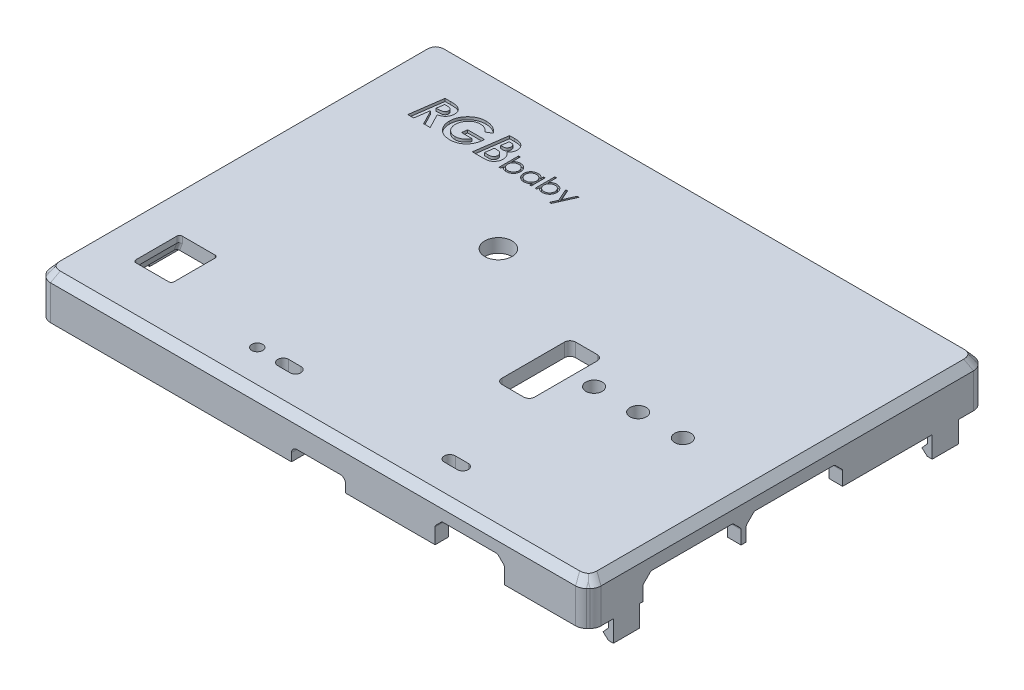
from build123d import *
from OCP.BRepFilletAPI import BRepFilletAPI_MakeChamfer

# Parameters (mm, degrees)
SKETCH1_W           = 101
SKETCH1_H           = 73
BOSS_EXTRUDE1_DEPTH = 7.85
SHELL3_T            = -2.5
SKETCH2_W           = 9.94
SKETCH2_H           = 2.46
CUT_EXTRUDE1_DEPTH  = 10
SKETCH3_W           = 12.7
SKETCH3_H           = 4.29
CUT_EXTRUDE2_DEPTH  = 10
SKETCH4_W           = 18.026547022
SKETCH4_H           = 4.15
SKETCH4_W_2         = 17.7
CUT_EXTRUDE3_DEPTH  = 10
SKETCH5_W           = 22.18
SKETCH5_H           = 1.5
CUT_EXTRUDE4_DEPTH  = 10
SKETCH6_W           = 18.18
SKETCH6_H           = 1.5
CUT_EXTRUDE5_DEPTH  = 10
SKETCH7_W           = 8
SKETCH7_H           = 5
CUT_EXTRUDE6_DEPTH  = 10
FILLET1_R           = 0.5
FILLET2_R           = 1
CHAMFER1_SIZE       = 1.25
CHAMFER2_SIZE       = 1.5
FILLET3_R           = 0.5
CHAMFER3_SIZE       = 1.5
CHAMFER4_SIZE       = 1.5
CHAMFER4_SIZE2      = 1.258649447
FILLET4_R           = 2
FILLET5_R           = 2.6
SKETCH8_W           = 7
SKETCH8_H           = 8.5
CUT_EXTRUDE7_DEPTH  = 5
CHAMFER5_SIZE       = 0.5
CHAMFER5_SIZE2      = 1.37373871
SKETCH9_R           = 1
SKETCH9_W           = 6
SKETCH9_H           = 13.5
SKETCH9_R_2         = 1.5
SKETCH9_R_3         = 2.5
CUT_EXTRUDE8_DEPTH  = 63.538968
FILLET6_R           = 1
CUT_EXTRUDE9_DEPTH  = 0.5
FILLET7_R           = 0.5
SKETCH11_W          = 0.9
SKETCH11_H          = 4.8
BOSS_EXTRUDE2_DEPTH = 3.9
SKETCH12_W          = 0.9
SKETCH12_H          = 4.8
BOSS_EXTRUDE3_DEPTH = 3.9
SKETCH13_W          = 0.9
SKETCH13_H          = 4.8
BOSS_EXTRUDE4_DEPTH = 3.9
SKETCH15_W          = 0.9
SKETCH15_H          = 4.8
BOSS_EXTRUDE6_DEPTH = 3.9
BOSS_EXTRUDE7_DEPTH = 4.8
BOSS_EXTRUDE8_DEPTH = 4.8


with BuildPart() as part:
    # Sketch1 → Boss-Extrude1 (new body)
    with BuildSketch(Plane(origin=(0, 0, 0), x_dir=(1, 0, 0), z_dir=(0, 1, 0))):
        Rectangle(SKETCH1_W, SKETCH1_H)
    extrude(amount=BOSS_EXTRUDE1_DEPTH)

    # Shell3
    shell3_openings = [part.faces().sort_by_distance(p)[0] for p in [
        (0, 0, 0),
    ]]
    offset(amount=SHELL3_T, openings=shell3_openings, kind=Kind.INTERSECTION)

    # Sketch2 → Cut-Extrude1 (cut)
    with BuildSketch(Plane.XY.offset(36.5)):
        with Locations((1.01, 1.23)):
            Rectangle(SKETCH2_W, SKETCH2_H)
    extrude(amount=-CUT_EXTRUDE1_DEPTH, mode=Mode.SUBTRACT)

    # Sketch3 → Cut-Extrude2 (cut)
    with BuildSketch(Plane.XY.offset(36.5)):
        with Locations((28.744046951, 2.145)):
            Rectangle(SKETCH3_W, SKETCH3_H)
    extrude(amount=-CUT_EXTRUDE2_DEPTH, mode=Mode.SUBTRACT)

    # Sketch4 → Cut-Extrude3 (cut)
    with BuildSketch(Plane(origin=(50.5, 0, 0), x_dir=(0, 0, -1), z_dir=(1, 0, 0))):
        with Locations((-17.486726489, 2.075)):
            Rectangle(SKETCH4_W, SKETCH4_H)
        with Locations((1.314047022, 2.075)):
            Rectangle(SKETCH4_W_2, SKETCH4_H)
    extrude(amount=-CUT_EXTRUDE3_DEPTH, mode=Mode.SUBTRACT)

    # Sketch5 → Cut-Extrude4 (cut)
    with BuildSketch(Plane(origin=(0, 0, -36.5), x_dir=(-1, 0, 0), z_dir=(0, 0, -1))):
        with Locations((-31.75, 0.75)):
            Rectangle(SKETCH5_W, SKETCH5_H)
        with Locations((0.25, 0.75)):
            Rectangle(SKETCH5_W, SKETCH5_H)
        with Locations((32.25, 0.75)):
            Rectangle(SKETCH5_W, SKETCH5_H)
    extrude(amount=-CUT_EXTRUDE4_DEPTH, mode=Mode.SUBTRACT)

    # Sketch6 → Cut-Extrude5 (cut)
    with BuildSketch(Plane.ZY.offset(50.5)):
        with Locations((3.45, 0.75)):
            Rectangle(SKETCH6_W, SKETCH6_H)
    extrude(amount=-CUT_EXTRUDE5_DEPTH, mode=Mode.SUBTRACT)

    # Sketch7 → Cut-Extrude6 (cut)
    with BuildSketch(Plane.ZY.offset(50.5)):
        with Locations((22.5, 2.5)):
            Rectangle(SKETCH7_W, SKETCH7_H)
    extrude(amount=-CUT_EXTRUDE6_DEPTH, mode=Mode.SUBTRACT)

    # Fillet1
    fillet1_edges = [part.edges().sort_by_distance(p)[0] for p in [
        (42.84, 1.5, -35.25),
        (20.66, 1.5, -35.25),
        (10.84, 1.5, -35.25),
        (-11.34, 1.5, -35.25),
        (-21.16, 1.5, -35.25),
        (-43.34, 1.5, -35.25),
        (-49.25, 1.5, -5.64),
        (-49.25, 1.5, 12.54),
    ]]
    fillet(fillet1_edges, radius=FILLET1_R)

    # Fillet2
    fillet2_edges = [part.edges().sort_by_distance(p)[0] for p in [
        (-3.96, 2.46, 35.25),
        (5.98, 2.46, 35.25),
    ]]
    fillet(fillet2_edges, radius=FILLET2_R)

    # Chamfer1
    chamfer1_edges = [part.edges().sort_by_distance(p)[0] for p in [
        (22.394046951, 4.29, 35.25),
        (35.094046951, 4.29, 35.25),
    ]]
    chamfer(chamfer1_edges, length=CHAMFER1_SIZE)

    # Chamfer2
    chamfer2_edges = [part.edges().sort_by_distance(p)[0] for p in [
        (49.25, 4.15, 26.5),
        (49.25, 4.15, 8.473452978),
        (49.25, 4.15, 7.535952978),
        (49.25, 4.15, -10.164047022),
    ]]
    chamfer(chamfer2_edges, length=CHAMFER2_SIZE)

    # Fillet3
    fillet3_edges = [part.edges().sort_by_distance(p)[0] for p in [
        (23.644046951, 4.29, 35.25),
        (33.844046951, 4.29, 35.25),
        (35.094046951, 3.04, 35.25),
        (22.394046951, 3.04, 35.25),
        (49.25, 4.15, 6.035952978),
        (49.25, 4.15, -8.664047022),
        (49.25, 2.65, -10.164047022),
        (49.25, 2.65, 7.535952978),
        (49.25, 4.15, 25),
        (49.25, 4.15, 9.973452978),
        (49.25, 2.65, 8.473452978),
        (49.25, 2.65, 26.5),
    ]]
    fillet(fillet3_edges, radius=FILLET3_R)

    # Chamfer3
    chamfer3_edges = [part.edges().sort_by_distance(p)[0] for p in [
        (50.5, 3.925, 36.5),
        (-50.5, 3.925, 36.5),
        (-50.5, 3.925, -36.5),
        (50.5, 3.925, -36.5),
    ]]
    chamfer(chamfer3_edges, length=CHAMFER3_SIZE)

    # Chamfer4: one chamfer whose edges measure the first distance from different faces: ONE call of the kernel's chamfer builder (chamfer() names one face for all edges)
    chamfer4_edges_1 = [part.edges().sort_by_distance(p)[0] for p in [
        (-50.5, 7.85, 0),
    ]]
    chamfer4_side_1 = [part.faces().sort_by_distance(p)[0] for p in [
        (-50.5, 4.222115859, -2.060200009),
    ]]
    chamfer4_edges_2 = [part.edges().sort_by_distance(p)[0] for p in [
        (0, 7.85, -36.5),
    ]]
    chamfer4_side_2 = [part.faces().sort_by_distance(p)[0] for p in [
        (0.037132849, 4.39689395, -36.5),
    ]]
    chamfer4_edges_3 = [part.edges().sort_by_distance(p)[0] for p in [
        (50.5, 7.85, 0),
    ]]
    chamfer4_side_3 = [part.faces().sort_by_distance(p)[0] for p in [
        (50.5, 4.597854749, -2.895488649),
    ]]
    chamfer4_edges_4 = [part.edges().sort_by_distance(p)[0] for p in [
        (0, 7.85, 36.5),
    ]]
    chamfer4_side_4 = [part.faces().sort_by_distance(p)[0] for p in [
        (-2.23114362, 4.159073824, 36.5),
    ]]
    chamfer4_edges_5 = [part.edges().sort_by_distance(p)[0] for p in [
        (-49.75, 7.85, 35.75),
    ]]
    chamfer4_side_5 = [part.faces().sort_by_distance(p)[0] for p in [
        (-49.75, 3.925, 35.75),
    ]]
    chamfer4_edges_6 = [part.edges().sort_by_distance(p)[0] for p in [
        (49.75, 7.85, 35.75),
    ]]
    chamfer4_side_6 = [part.faces().sort_by_distance(p)[0] for p in [
        (49.75, 3.925, 35.75),
    ]]
    chamfer4_edges_7 = [part.edges().sort_by_distance(p)[0] for p in [
        (49.75, 7.85, -35.75),
    ]]
    chamfer4_side_7 = [part.faces().sort_by_distance(p)[0] for p in [
        (49.75, 3.925, -35.75),
    ]]
    chamfer4_edges_8 = [part.edges().sort_by_distance(p)[0] for p in [
        (-49.75, 7.85, -35.75),
    ]]
    chamfer4_side_8 = [part.faces().sort_by_distance(p)[0] for p in [
        (-49.75, 3.925, -35.75),
    ]]
    chamfer4 = BRepFilletAPI_MakeChamfer(part.part.solid().wrapped)
    for e in chamfer4_edges_1:
        chamfer4.Add(CHAMFER4_SIZE, CHAMFER4_SIZE2, e.wrapped, chamfer4_side_1[0].wrapped)  # the first distance lies on this face
    for e in chamfer4_edges_2:
        chamfer4.Add(CHAMFER4_SIZE, CHAMFER4_SIZE2, e.wrapped, chamfer4_side_2[0].wrapped)  # the first distance lies on this face
    for e in chamfer4_edges_3:
        chamfer4.Add(CHAMFER4_SIZE, CHAMFER4_SIZE2, e.wrapped, chamfer4_side_3[0].wrapped)  # the first distance lies on this face
    for e in chamfer4_edges_4:
        chamfer4.Add(CHAMFER4_SIZE, CHAMFER4_SIZE2, e.wrapped, chamfer4_side_4[0].wrapped)  # the first distance lies on this face
    for e in chamfer4_edges_5:
        chamfer4.Add(CHAMFER4_SIZE, CHAMFER4_SIZE2, e.wrapped, chamfer4_side_5[0].wrapped)  # the first distance lies on this face
    for e in chamfer4_edges_6:
        chamfer4.Add(CHAMFER4_SIZE, CHAMFER4_SIZE2, e.wrapped, chamfer4_side_6[0].wrapped)  # the first distance lies on this face
    for e in chamfer4_edges_7:
        chamfer4.Add(CHAMFER4_SIZE, CHAMFER4_SIZE2, e.wrapped, chamfer4_side_7[0].wrapped)  # the first distance lies on this face
    for e in chamfer4_edges_8:
        chamfer4.Add(CHAMFER4_SIZE, CHAMFER4_SIZE2, e.wrapped, chamfer4_side_8[0].wrapped)  # the first distance lies on this face
    add(Compound.cast(chamfer4.Shape()), mode=Mode.REPLACE)

    # Fillet4
    fillet4_edges = [part.edges().sort_by_distance(p)[0] for p in [
        (-50.5, 3.175, 35),
        (-49, 3.175, -36.5),
        (50.5, 3.175, -35),
        (49, 3.175, 36.5),
        (49, 3.175, -36.5),
        (50.5, 3.175, 35),
        (-49, 3.175, 36.5),
        (-50.5, 3.175, -35),
    ]]
    fillet(fillet4_edges, radius=FILLET4_R)

    # Fillet5
    # the kernel refuses this fillet: 2.6 mm, written as the material it takes off along each edge
    with BuildSketch(Plane(origin=(-49.449728711, 5.05606408, -37.585741153), x_dir=(-0.80024425838159, -0.1970939943978457, 0.5663595009352286), z_dir=(0.2572879369705646, 0.7402553925543305, 0.6211480268693323)), Plane(origin=(-51.585741153, 5.05606408, -35.449728711), x_dir=(-0.16538149800648996, -0.19709399439784686, 0.966334785407951), z_dir=(0.6211480268693325, 0.7402553925543306, 0.25728793697056446)), Plane(origin=(51.585741153, 5.05606408, 35.449728711), x_dir=(0.1653814980064904, -0.19709399439784625, -0.966334785407951), z_dir=(-0.6211480268693326, 0.7402553925543306, -0.2572879369705643)), Plane(origin=(49.449728711, 5.05606408, 37.585741153), x_dir=(0.8002442583815859, -0.19709399439785075, -0.5663595009352324), z_dir=(-0.2572879369705643, 0.7402553925543306, -0.6211480268693326)), Plane(origin=(-49.449728711, 5.05606408, 37.585741153), x_dir=(0.9663347854079509, -0.1970939943978456, 0.16538149800649174), z_dir=(0.2572879369705646, 0.7402553925543305, -0.6211480268693323))) as fillet5_piece_1:
        with BuildLine():
            CenterArc((FILLET5_R * 0.306623823216, FILLET5_R), FILLET5_R, 235.906425585, 34.093574415)
            Line((-FILLET5_R * 0.253922302826, FILLET5_R * 0.171876796256), (0, 0))
            Line((0, 0), (FILLET5_R * 0.306623823216, 0))
        make_face()
    extrude(amount=5.767341331, mode=Mode.SUBTRACT)
    with BuildSketch(Plane(origin=(49.449728711, 5.05606408, -37.585741153), x_dir=(0.8002442583815883, -0.19709399439784797, 0.56635950093523), z_dir=(-0.2572879369705643, 0.7402553925543306, 0.6211480268693326)), Plane(origin=(51.585741153, 5.05606408, -35.449728711), x_dir=(0.1653814980064918, -0.19709399439784506, 0.966334785407951), z_dir=(-0.6211480268693326, 0.7402553925543306, 0.2572879369705643)), Plane(origin=(-51.585741153, 5.05606408, 35.449728711), x_dir=(-0.1653814980064911, -0.19709399439784595, -0.966334785407951), z_dir=(0.6211480268693325, 0.7402553925543306, -0.25728793697056446))) as fillet5_piece_2:
        with BuildLine():
            CenterArc((FILLET5_R * 0.306623823216, -FILLET5_R), FILLET5_R, 90, 34.093574415)
            Line((-FILLET5_R * 0.253922302826, -FILLET5_R * 0.171876796256), (0, 0))
            Line((0, 0), (FILLET5_R * 0.306623823216, 0))
        make_face()
    extrude(amount=5.767341331, mode=Mode.SUBTRACT)

    # Sketch8 → Cut-Extrude7 (cut)
    with BuildSketch(Plane(origin=(0, 7.85, 0), x_dir=(1, 0, 0), z_dir=(0, 1, 0))):
        with Locations((-39, -22.75)):
            Rectangle(SKETCH8_W, SKETCH8_H)
    extrude(amount=-CUT_EXTRUDE7_DEPTH, mode=Mode.SUBTRACT)

    # Chamfer5
    chamfer5_edges = [part.edges().sort_by_distance(p)[0] for p in [
        (-42.5, 5.35, 22.75),
    ]]
    chamfer5_side = [part.faces().sort_by_distance(p)[0] for p in [
        (0.358738502, 5.35, -0.209264126),
    ]]
    chamfer(chamfer5_edges, length=CHAMFER5_SIZE, length2=CHAMFER5_SIZE2, reference=chamfer5_side[0])

    # Sketch9 → Cut-Extrude8 (cut, through all)
    with BuildSketch(Plane.XZ.offset(-5.35)):
        with Locations((20.35, 29.37)):
            Circle(SKETCH9_R)
        with BuildLine():
            ThreePointArc((20.35, 28.37), (19.35, 29.37), (20.35, 30.37))
            Line((20.35, 30.37), (17.96125, 30.37))
            ThreePointArc((17.96125, 30.37), (18.668356781, 30.077106781), (18.96125, 29.37))
            ThreePointArc((18.96125, 29.37), (18.668356781, 28.662893219), (17.96125, 28.37))
            Line((17.96125, 28.37), (20.35, 28.37))
        make_face()
        with Locations((17.96125, 29.37)):
            Circle(SKETCH9_R)
        with Locations((-10.4, 29.32625)):
            Circle(SKETCH9_R)
        with BuildLine():
            Line((-12.65, 28.32625), (-10.4, 28.32625))
            ThreePointArc((-10.4, 28.32625), (-11.4, 29.32625), (-10.4, 30.32625))
            Line((-10.4, 30.32625), (-12.65, 30.32625))
            ThreePointArc((-12.65, 30.32625), (-11.942893219, 30.033356781), (-11.65, 29.32625))
            ThreePointArc((-11.65, 29.32625), (-11.942893219, 28.619143219), (-12.65, 28.32625))
        make_face()
        with Locations((-12.65, 29.32625)):
            Circle(SKETCH9_R)
        with Locations((12.9, 6)):
            Rectangle(SKETCH9_W, SKETCH9_H)
        with Locations(Location((36, 4.65, 0), (0, 0, 270))):
            Circle(SKETCH9_R_2)
        with Locations(Location((27.8, 4.65, 0), (0, 0, 270))):
            Circle(SKETCH9_R_2)
        with Locations(Location((19.7, 4.65, 0), (0, 0, 270))):
            Circle(SKETCH9_R_2)
        with Locations(Location((-11, -8.5, 0), (0, 0, 270))):
            Circle(SKETCH9_R_3)
        with Locations(Location((-17.43875, 29.30125, 0), (0, 0, 270))):
            Circle(SKETCH9_R)
    extrude(amount=-CUT_EXTRUDE8_DEPTH, mode=Mode.SUBTRACT)

    # Fillet6
    fillet6_edges = [part.edges().sort_by_distance(p)[0] for p in [
        (9.9, 6.6, -0.75),
        (9.9, 6.6, 12.75),
        (15.9, 6.6, 12.75),
        (15.9, 6.6, -0.75),
    ]]
    fillet(fillet6_edges, radius=FILLET6_R)

    # Sketch10 → Cut-Extrude9 (cut)
    # profile 1 of 7: a face of its own
    with BuildSketch(Plane(origin=(0, 7.85, 0), x_dir=(1, 0, 0), z_dir=(0, 1, 0))):
        with BuildLine():
            Line((-27.938465938, 27.5), (-27.039427476, 27.5))
            add(Edge.make_bspline(
                [(-27.039427476, 27.5), (-26.973306911, 27.499796766), (-26.845395145, 27.499403605), (-26.660222494, 27.489100944), (-26.487884601, 27.474724122), (-26.328360899, 27.456808782), (-26.182536115, 27.429710381), (-26.049507455, 27.398924327), (-25.929433848, 27.3624692), (-25.788389528, 27.304492776), (-25.629097559, 27.216104064), (-25.455127636, 27.086988544), (-25.304920913, 26.927752866), (-25.17331302, 26.748955846), (-25.066332591, 26.553117065), (-24.990513856, 26.345635951), (-24.942686866, 26.130772449), (-24.936681121, 25.984620467), (-24.933658246, 25.911057692)],
                knots=[0, 0, 0, 0, 1.060182399, 2.050947427, 2.972933909, 3.833603532, 4.623758792, 5.349968742, 6.022619805, 6.633490032, 7.792338899, 8.934684725, 10.0933911, 11.288487101, 12.487324871, 13.658169267, 14.821284765, 16, 16, 16, 16], degree=3))
            add(Edge.make_bspline(
                [(-24.933658246, 25.911057692), (-24.935904326, 25.849246744), (-24.940350186, 25.72689903), (-24.970895701, 25.545923474), (-25.023326617, 25.370716813), (-25.094804204, 25.201801173), (-25.18636653, 25.042720693), (-25.296633818, 24.895946559), (-25.425690991, 24.762795521), (-25.523647396, 24.686393165), (-25.573081322, 24.647836538)],
                knots=[0, 0, 0, 0, 1.008802286, 1.996808917, 2.985853824, 3.987935791, 4.984003692, 5.974085787, 6.977617699, 8, 8, 8, 8], degree=3))
            add(Edge.make_bspline(
                [(-25.573081322, 24.647836538), (-25.509796832, 24.600790122), (-25.386202057, 24.50890835), (-25.224619016, 24.349933059), (-25.087509165, 24.180565271), (-24.97370108, 24.000049287), (-24.887403901, 23.806230756), (-24.824457751, 23.601758575), (-24.786066713, 23.385655501), (-24.781925351, 23.237738765), (-24.779812092, 23.162259615)],
                knots=[0, 0, 0, 0, 1.076867414, 2.103124847, 3.088410714, 4.050300241, 5.011160291, 5.979497965, 6.968975523, 8, 8, 8, 8], degree=3))
            add(Edge.make_bspline(
                [(-24.779812092, 23.162259615), (-24.782758992, 23.08350271), (-24.788586361, 22.927764278), (-24.836834505, 22.699579974), (-24.917099914, 22.4820053), (-25.027844555, 22.278598159), (-25.159212366, 22.092327808), (-25.309857214, 21.93087079), (-25.474252088, 21.794811741), (-25.624852739, 21.70218801), (-25.756058904, 21.643141776), (-25.864680812, 21.604930544), (-25.983514047, 21.572158262), (-26.113035764, 21.546827689), (-26.252406745, 21.524336437), (-26.402225844, 21.511223627), (-26.562110246, 21.500524167), (-26.672418939, 21.500178396), (-26.729331322, 21.5)],
                knots=[0, 0, 0, 0, 1.303747164, 2.57810456, 3.844347155, 5.133141427, 6.403898642, 7.610790585, 8.780141826, 9.92981316, 10.526901919, 11.160883678, 11.835562906, 12.567100275, 13.346228134, 14.173084326, 15.057425816, 16, 16, 16, 16], degree=3))
            Line((-26.729331322, 21.5), (-28.779812092, 21.5))
            Line((-28.779812092, 21.5), (-27.938465938, 27.5))
        make_face()
        with BuildLine():
            Line((-27.188465938, 25.115384615), (-26.991350553, 25.115384615))
            add(Edge.make_bspline(
                [(-26.991350553, 25.115384615), (-26.955686885, 25.115543058), (-26.887545067, 25.115845791), (-26.790212621, 25.120071591), (-26.701498173, 25.123831029), (-26.62224478, 25.132813021), (-26.551117652, 25.141890782), (-26.489511522, 25.154208823), (-26.435805768, 25.16612664), (-26.377405446, 25.189760122), (-26.310824717, 25.224951473), (-26.240770609, 25.284991027), (-26.175375062, 25.357206629), (-26.118540444, 25.443788017), (-26.070732971, 25.540067667), (-26.035904248, 25.643533506), (-26.014781688, 25.752353204), (-26.011999422, 25.826427567), (-26.010581322, 25.864182692)],
                knots=[0, 0, 0, 0, 1.199333927, 2.291542006, 3.276678834, 4.184405191, 4.973343612, 5.686872737, 6.298011521, 6.818495195, 7.801417815, 8.815884106, 9.903594398, 11.069613373, 12.286904311, 13.509850177, 14.730790054, 16, 16, 16, 16], degree=3))
            add(Edge.make_bspline(
                [(-26.010581322, 25.864182692), (-26.011706555, 25.898712141), (-26.013907801, 25.9662607), (-26.031812141, 26.06349409), (-26.062482293, 26.153271997), (-26.104347003, 26.234583369), (-26.15547557, 26.306538758), (-26.21501617, 26.367140492), (-26.283670172, 26.413086048), (-26.347560463, 26.442085587), (-26.406247712, 26.45948311), (-26.46069664, 26.469606119), (-26.52483125, 26.479247929), (-26.598972172, 26.487639296), (-26.683181009, 26.493477903), (-26.777389272, 26.496663876), (-26.881562731, 26.499141521), (-26.954489897, 26.499705595), (-26.992552476, 26.5)],
                knots=[0, 0, 0, 0, 1.217888189, 2.382505203, 3.473394342, 4.554621668, 5.598222957, 6.577909812, 7.534682879, 8.496456537, 9.042175867, 9.690967717, 10.448749248, 11.330850431, 12.323004962, 13.426554395, 14.656852007, 16, 16, 16, 16], degree=3))
            Line((-26.992552476, 26.5), (-27.188465938, 25.115384615))
        make_face(mode=Mode.SUBTRACT)
        with BuildLine():
            Line((-27.55264863, 22.5), (-26.857937092, 22.475961538))
            add(Edge.make_bspline(
                [(-26.857937092, 22.475961538), (-26.815849239, 22.476688308), (-26.734364798, 22.478095375), (-26.616384382, 22.487896615), (-26.507004555, 22.502855583), (-26.40666669, 22.525269525), (-26.316244309, 22.556041714), (-26.233482433, 22.590296615), (-26.159580837, 22.632180679), (-26.095303876, 22.682464857), (-26.039104624, 22.737499566), (-25.98982001, 22.797263395), (-25.949511634, 22.862298951), (-25.914936449, 22.931684803), (-25.889151882, 23.006129065), (-25.869207183, 23.085237323), (-25.858852299, 23.169192803), (-25.857448973, 23.226738765), (-25.856735169, 23.256009615)],
                knots=[0, 0, 0, 0, 1.396545255, 2.703789819, 3.925918336, 5.057947269, 6.109009747, 7.09185152, 8.026860065, 8.917724649, 9.79206713, 10.633022212, 11.481406092, 12.325717456, 13.200363125, 14.090334412, 15.028645384, 16, 16, 16, 16], degree=3))
            add(Edge.make_bspline(
                [(-25.856735169, 23.256009615), (-25.858720841, 23.299398319), (-25.862601836, 23.384201479), (-25.889199465, 23.508480284), (-25.937279283, 23.624184642), (-26.00077132, 23.732542817), (-26.079281494, 23.82964293), (-26.172617726, 23.911662592), (-26.277802208, 23.977893481), (-26.375940572, 24.020673282), (-26.465196392, 24.048147706), (-26.547592875, 24.063547955), (-26.643180618, 24.079934742), (-26.753291846, 24.090652494), (-26.876582767, 24.102308798), (-27.014140374, 24.108684429), (-27.165594252, 24.113677441), (-27.271393475, 24.114798644), (-27.326687092, 24.115384615)],
                knots=[0, 0, 0, 0, 1.072622611, 2.096439365, 3.122744367, 4.15723709, 5.19210906, 6.195602288, 7.215049995, 8.252903698, 8.832552919, 9.520188734, 10.322946655, 11.229686895, 12.253743166, 13.384425235, 14.63302787, 16, 16, 16, 16], degree=3))
            Line((-27.326687092, 24.115384615), (-27.55264863, 22.5))
        make_face(mode=Mode.SUBTRACT)
    # profile 2 of 7: a face of its own
    with BuildSketch(Plane(origin=(0, 7.85, 0), x_dir=(1, 0, 0), z_dir=(0, 1, 0))):
        with BuildLine():
            Line((-29.803850553, 26.40625), (-30.759379399, 25.807692308))
            add(Edge.make_bspline(
                [(-30.759379399, 25.807692308), (-30.827150089, 25.881720893), (-30.956616747, 26.023142408), (-31.159685734, 26.208048813), (-31.359725046, 26.356960563), (-31.559833042, 26.470325096), (-31.764563752, 26.554511995), (-31.979636577, 26.611152641), (-32.207290275, 26.647172135), (-32.363406319, 26.651587368), (-32.44327363, 26.653846154)],
                knots=[0, 0, 0, 0, 1.232977487, 2.355435308, 3.369770187, 4.291348691, 5.174604885, 6.082334442, 7.018942652, 8, 8, 8, 8], degree=3))
            add(Edge.make_bspline(
                [(-32.44327363, 26.653846154), (-32.52999285, 26.65154757), (-32.700426933, 26.647030035), (-32.949005381, 26.60428078), (-33.185853633, 26.538899144), (-33.409958265, 26.444197902), (-33.621454694, 26.321658594), (-33.820596682, 26.172802989), (-34.007523472, 25.997486703), (-34.117771684, 25.863871082), (-34.174042861, 25.795673077)],
                knots=[0, 0, 0, 0, 1.037106879, 2.038283569, 3.009830787, 3.972569298, 4.94146214, 5.928319872, 6.942605276, 8, 8, 8, 8], degree=3))
            add(Edge.make_bspline(
                [(-34.174042861, 25.795673077), (-34.216314266, 25.738664053), (-34.299819415, 25.626045438), (-34.406410435, 25.446819054), (-34.498260097, 25.264308083), (-34.57355574, 25.07668609), (-34.631168643, 24.884320563), (-34.671858807, 24.686832412), (-34.698161025, 24.485083754), (-34.701307363, 24.348638552), (-34.702889015, 24.280048077)],
                knots=[0, 0, 0, 0, 1.040960542, 2.056368018, 3.055559505, 4.03710588, 5.019268411, 5.998275661, 6.99374091, 8, 8, 8, 8], degree=3))
            add(Edge.make_bspline(
                [(-34.702889015, 24.280048077), (-34.701270541, 24.213071765), (-34.698079907, 24.081035648), (-34.672943543, 23.887210308), (-34.628648734, 23.702107602), (-34.570567364, 23.52432124), (-34.492788772, 23.355462533), (-34.398644999, 23.194771624), (-34.287364808, 23.042683806), (-34.160334453, 22.900466694), (-34.021341109, 22.770621789), (-33.872946948, 22.656814227), (-33.716599511, 22.561021227), (-33.552236107, 22.482580174), (-33.379959036, 22.420839809), (-33.19934589, 22.378022983), (-33.011432331, 22.350472579), (-32.883275539, 22.347607189), (-32.81827363, 22.346153846)],
                knots=[0, 0, 0, 0, 1.066897471, 2.103265977, 3.106535126, 4.095591644, 5.078159493, 6.062322472, 7.058152725, 8.075375883, 9.096057735, 10.084186963, 11.049730852, 12.011871914, 12.980953841, 13.959387168, 14.96498868, 16, 16, 16, 16], degree=3))
            add(Edge.make_bspline(
                [(-32.81827363, 22.346153846), (-32.769360001, 22.34706009), (-32.672519325, 22.3488543), (-32.5291292, 22.363698843), (-32.388993194, 22.387810082), (-32.252297668, 22.421129865), (-32.119057085, 22.464941071), (-31.988990514, 22.518046446), (-31.861739284, 22.580097746), (-31.738721089, 22.652922581), (-31.619738854, 22.734178996), (-31.506474627, 22.825900641), (-31.399182289, 22.927519024), (-31.297001754, 23.038498963), (-31.199265627, 23.158248714), (-31.10945936, 23.289270146), (-31.023572557, 23.428672009), (-30.971949417, 23.526921932), (-30.945677476, 23.576923077)],
                knots=[0, 0, 0, 0, 0.990751711, 1.961520103, 2.916931976, 3.869720035, 4.809138875, 5.755683625, 6.713987145, 7.674487982, 8.649319602, 9.630449541, 10.623757948, 11.640402946, 12.684918653, 13.752145235, 14.856026455, 16, 16, 16, 16], degree=3))
            Line((-30.945677476, 23.576923077), (-32.839908246, 23.576923077))
            Line((-32.839908246, 23.576923077), (-32.702889015, 24.576923077))
            Line((-32.702889015, 24.576923077), (-29.625965938, 24.576923077))
            add(Edge.make_bspline(
                [(-29.625965938, 24.576923077), (-29.633662367, 24.456143012), (-29.648713052, 24.219952603), (-29.703180253, 23.876031243), (-29.783848353, 23.551688932), (-29.888412933, 23.245675998), (-30.017929687, 22.958563204), (-30.174411493, 22.691128756), (-30.354792286, 22.442367157), (-30.560710697, 22.215539485), (-30.786192182, 22.012010124), (-31.027021293, 21.832197513), (-31.285026585, 21.683045856), (-31.556768725, 21.559837618), (-31.843317222, 21.462932821), (-32.145400619, 21.394996192), (-32.462524833, 21.353120404), (-32.679119752, 21.348504592), (-32.789427476, 21.346153846)],
                knots=[0, 0, 0, 0, 1.148955532, 2.246830018, 3.301660101, 4.319666133, 5.314146826, 6.287838685, 7.257462643, 8.227280698, 9.191724348, 10.138440807, 11.076252923, 12.016254752, 12.968042649, 13.943717582, 14.952773983, 16, 16, 16, 16], degree=3))
            add(Edge.make_bspline(
                [(-32.789427476, 21.346153846), (-32.849942994, 21.346753916), (-32.969495478, 21.347939396), (-33.146027354, 21.360117635), (-33.317598889, 21.380909245), (-33.484102264, 21.408219315), (-33.646271573, 21.443125548), (-33.803273041, 21.486110817), (-33.955470983, 21.537781195), (-34.101913158, 21.599000995), (-34.245717837, 21.663594336), (-34.382421637, 21.740543093), (-34.515385439, 21.823137616), (-34.642518621, 21.914947444), (-34.765737577, 22.013532471), (-34.883175728, 22.120469956), (-34.995860675, 22.235336267), (-35.066302493, 22.316915499), (-35.101927476, 22.358173077)],
                knots=[0, 0, 0, 0, 1.111499042, 2.195841241, 3.24834816, 4.285223882, 5.294222847, 6.294054786, 7.273859608, 8.244193736, 9.208986092, 10.167555097, 11.123181443, 12.083077344, 13.046240314, 14.020501641, 14.998895854, 16, 16, 16, 16], degree=3))
            add(Edge.make_bspline(
                [(-35.101927476, 22.358173077), (-35.156079559, 22.426563494), (-35.263596361, 22.562349943), (-35.401619432, 22.781140437), (-35.519405221, 23.009316328), (-35.613729692, 23.248043422), (-35.68913792, 23.495479252), (-35.74177777, 23.752983597), (-35.773447065, 24.020037297), (-35.777672807, 24.201435988), (-35.779812092, 24.293269231)],
                knots=[0, 0, 0, 0, 0.999328569, 1.984127054, 2.959716786, 3.938705326, 4.922250225, 5.921072174, 6.947541011, 8, 8, 8, 8], degree=3))
            add(Edge.make_bspline(
                [(-35.779812092, 24.293269231), (-35.776938549, 24.405626125), (-35.771268347, 24.627333795), (-35.722377282, 24.953296043), (-35.646329478, 25.268276063), (-35.53567681, 25.570696501), (-35.395994332, 25.862273597), (-35.223435364, 26.140770128), (-35.022179487, 26.40928444), (-34.790469272, 26.660506601), (-34.539189861, 26.892684636), (-34.272370503, 27.096629674), (-33.992584466, 27.268295903), (-33.70211446, 27.410455856), (-33.398187825, 27.518545433), (-33.083475878, 27.59677379), (-32.756475376, 27.645249992), (-32.534386548, 27.650951617), (-32.421639015, 27.653846154)],
                knots=[0, 0, 0, 0, 1.022519879, 2.01768214, 2.99445506, 3.968403767, 4.944092992, 5.933246428, 6.946641619, 7.994936793, 9.040543676, 10.058341478, 11.047494914, 12.024771785, 12.997483176, 13.978673844, 14.973836105, 16, 16, 16, 16], degree=3))
            add(Edge.make_bspline(
                [(-32.421639015, 27.653846154), (-32.337017832, 27.652474785), (-32.168516319, 27.649744055), (-31.918046072, 27.620165604), (-31.670298838, 27.576696975), (-31.427674271, 27.51232779), (-31.191766158, 27.433822868), (-30.965778536, 27.339842904), (-30.751891594, 27.230686256), (-30.548520589, 27.10526268), (-30.353646155, 26.962132578), (-30.16358463, 26.798637244), (-29.978930982, 26.612415007), (-29.86305134, 26.475961565), (-29.803850553, 26.40625)],
                knots=[0, 0, 0, 0, 1.014010841, 2.019144067, 3.019687909, 4.027399918, 5.025300219, 5.998481464, 6.958680332, 7.901091373, 8.859847597, 9.854378501, 10.903841272, 12, 12, 12, 12], degree=3))
        make_face()
    # profile 3 of 7: a face of its own
    with BuildSketch(Plane(origin=(0, 7.85, 0), x_dir=(1, 0, 0), z_dir=(0, 1, 0))):
        with BuildLine():
            Line((-39.784619784, 27.5), (-38.742552476, 27.5))
            add(Edge.make_bspline(
                [(-38.742552476, 27.5), (-38.665219817, 27.499683975), (-38.516113152, 27.49907464), (-38.301692918, 27.490409909), (-38.104891621, 27.477337499), (-37.925943266, 27.460085865), (-37.764698451, 27.436150188), (-37.621492493, 27.407410613), (-37.495410704, 27.375405092), (-37.4197999, 27.345663474), (-37.384379399, 27.331730769)],
                knots=[0, 0, 0, 0, 1.348808202, 2.600664361, 3.742342956, 4.788858012, 5.735658768, 6.584006912, 7.336666444, 8, 8, 8, 8], degree=3))
            add(Edge.make_bspline(
                [(-37.384379399, 27.331730769), (-37.344500471, 27.313747278), (-37.266543477, 27.278592397), (-37.154835649, 27.219002718), (-37.050229962, 27.154808461), (-36.954460069, 27.083589292), (-36.865504928, 27.008344021), (-36.783916142, 26.928356967), (-36.71035067, 26.842400575), (-36.644036459, 26.752016587), (-36.58507015, 26.657321902), (-36.534453649, 26.557849554), (-36.490686436, 26.454441702), (-36.456507872, 26.345973087), (-36.428101375, 26.233745754), (-36.409729084, 26.117051625), (-36.396799532, 25.996284328), (-36.395737119, 25.914299118), (-36.395196707, 25.872596154)],
                knots=[0, 0, 0, 0, 1.116361014, 2.182309107, 3.229450697, 4.24598407, 5.225421932, 6.201651319, 7.158895679, 8.110002388, 9.060669178, 10.002827475, 10.956240434, 11.923213192, 12.902917952, 13.908279153, 14.936015885, 16, 16, 16, 16], degree=3))
            add(Edge.make_bspline(
                [(-36.395196707, 25.872596154), (-36.39646762, 25.821277786), (-36.398976608, 25.719967019), (-36.415370863, 25.570570664), (-36.445948185, 25.427209351), (-36.487126617, 25.28943148), (-36.538143386, 25.156344954), (-36.603936186, 25.030265577), (-36.679984481, 24.908996572), (-36.767812501, 24.794127853), (-36.865981459, 24.684605685), (-36.97933221, 24.586875572), (-37.101594033, 24.494364886), (-37.237789613, 24.41327606), (-37.384173236, 24.337951763), (-37.544083706, 24.27413244), (-37.714519754, 24.215237055), (-37.834026403, 24.185760735), (-37.895196707, 24.170673077)],
                knots=[0, 0, 0, 0, 0.995453645, 1.965186658, 2.910129054, 3.83459069, 4.752398018, 5.669942118, 6.588407184, 7.525617038, 8.471772905, 9.435289717, 10.423772802, 11.441988612, 12.505459691, 13.613754905, 14.778583949, 16, 16, 16, 16], degree=3))
            Line((-37.895196707, 24.170673077), (-36.510581322, 21.5))
            Line((-36.510581322, 21.5), (-37.713706322, 21.5))
            Line((-37.713706322, 21.5), (-39.069475553, 24.115384615))
            Line((-39.069475553, 24.115384615), (-39.171639015, 24.115384615))
            Line((-39.171639015, 24.115384615), (-39.539427476, 21.5))
            Line((-39.539427476, 21.5), (-40.625965938, 21.5))
            Line((-40.625965938, 21.5), (-39.784619784, 27.5))
        make_face()
        with BuildLine():
            add(Edge.make_bspline(
                [(-39.031014015, 25.115384615), (-38.95367903, 25.116102712), (-38.805756662, 25.117476251), (-38.594494279, 25.127030209), (-38.403984347, 25.142121992), (-38.234776299, 25.163689135), (-38.086425025, 25.189195262), (-37.95956073, 25.221037838), (-37.853601925, 25.258898083), (-37.766877371, 25.303796552), (-37.696624509, 25.356511734), (-37.635817638, 25.412767096), (-37.585184978, 25.475738747), (-37.543408496, 25.544369523), (-37.511187672, 25.618801675), (-37.487951477, 25.699539472), (-37.475104, 25.786044585), (-37.473128976, 25.845712836), (-37.472119784, 25.876201923)],
                knots=[0, 0, 0, 0, 1.892208387, 3.619318591, 5.173427176, 6.566868293, 7.791773198, 8.8545744, 9.763297566, 10.539470204, 11.233547833, 11.906251103, 12.5615143, 13.203742025, 13.866659999, 14.539934446, 15.25394049, 16, 16, 16, 16], degree=3))
            add(Edge.make_bspline(
                [(-37.472119784, 25.876201923), (-37.473426143, 25.910772145), (-37.475960301, 25.977833638), (-37.49787973, 26.074421526), (-37.535361199, 26.162039859), (-37.588036296, 26.239850967), (-37.653771986, 26.308460949), (-37.733965924, 26.364969184), (-37.82770176, 26.409452037), (-37.91550988, 26.438840511), (-37.998624867, 26.455863067), (-38.07610405, 26.467299944), (-38.167837239, 26.478336123), (-38.274100362, 26.48649703), (-38.394765677, 26.491895317), (-38.52977175, 26.497140915), (-38.67884622, 26.499006279), (-38.78301749, 26.499658733), (-38.837504399, 26.5)],
                knots=[0, 0, 0, 0, 0.974340854, 1.890087692, 2.776057671, 3.647490651, 4.526730822, 5.442477659, 6.397820337, 7.445016909, 8.045730266, 8.789007992, 9.653967296, 10.651691253, 11.794598421, 13.061237498, 14.462876682, 16, 16, 16, 16], degree=3))
            Line((-38.837504399, 26.5), (-39.031014015, 25.115384615))
        make_face(mode=Mode.SUBTRACT)
    # profile 4 of 7: a face of its own
    with BuildSketch(Plane(origin=(0, 7.85, 0), x_dir=(1, 0, 0), z_dir=(0, 1, 0))):
        with BuildLine():
            Line((-23.882376194, 21.5), (-23.882376194, 25.08974359))
            Line((-23.882376194, 25.08974359), (-23.56827363, 25.08974359))
            Line((-23.56827363, 25.08974359), (-23.56827363, 23.593549679))
            add(Edge.make_bspline(
                [(-23.56827363, 23.593549679), (-23.532880211, 23.634307611), (-23.463826192, 23.713828017), (-23.34804974, 23.817675666), (-23.226644171, 23.905728144), (-23.098685915, 23.978314262), (-22.963992982, 24.033587869), (-22.823260873, 24.074010259), (-22.676129833, 24.098397162), (-22.575810659, 24.101163235), (-22.525004399, 24.102564103)],
                knots=[0, 0, 0, 0, 1.077089805, 2.101446609, 3.097517232, 4.067117542, 5.031729543, 5.997785507, 6.985986182, 8, 8, 8, 8], degree=3))
            add(Edge.make_bspline(
                [(-22.525004399, 24.102564103), (-22.479838262, 24.101323874), (-22.39053711, 24.098871732), (-22.259254963, 24.080237237), (-22.132941687, 24.050019435), (-22.01166604, 24.008127255), (-21.895993907, 23.952544278), (-21.78493485, 23.88600297), (-21.679057865, 23.806764641), (-21.58000298, 23.71616633), (-21.488709094, 23.617809708), (-21.408796584, 23.512629392), (-21.341296887, 23.402154302), (-21.285465595, 23.286754239), (-21.242294542, 23.165957888), (-21.212552275, 23.03988369), (-21.19365881, 22.908655671), (-21.191278564, 22.819342868), (-21.190068502, 22.773938301)],
                knots=[0, 0, 0, 0, 1.034377878, 2.045141349, 3.03070803, 4.00595497, 4.978199603, 5.965204761, 6.967410914, 8.002051993, 9.036360596, 10.037508045, 11.022711142, 11.997267194, 12.969246472, 13.954813154, 14.960274251, 16, 16, 16, 16], degree=3))
            add(Edge.make_bspline(
                [(-21.190068502, 22.773938301), (-21.191304942, 22.729238284), (-21.193743008, 22.641096888), (-21.212364317, 22.511390332), (-21.243110581, 22.386551633), (-21.287071765, 22.266903376), (-21.342336703, 22.151883462), (-21.411447979, 22.042803058), (-21.491258978, 21.937764082), (-21.583590127, 21.840140451), (-21.68350368, 21.749907051), (-21.790417923, 21.671501186), (-21.901639844, 21.603784066), (-22.018902957, 21.550128618), (-22.140470998, 21.506727697), (-22.267646385, 21.476610006), (-22.399709613, 21.459036951), (-22.489428501, 21.456441384), (-22.534820105, 21.455128205)],
                knots=[0, 0, 0, 0, 1.024244038, 2.01964794, 2.996620209, 3.965911562, 4.936179293, 5.91563013, 6.920572822, 7.955171681, 8.990768464, 10.002129126, 10.989675881, 11.969873457, 12.952483066, 13.943799762, 14.959703725, 16, 16, 16, 16], degree=3))
            add(Edge.make_bspline(
                [(-22.534820105, 21.455128205), (-22.586785217, 21.456568813), (-22.688679741, 21.459393595), (-22.837732406, 21.482812574), (-22.978813956, 21.522674184), (-23.113531504, 21.57623594), (-23.239959227, 21.648764594), (-23.35889981, 21.738721344), (-23.469603182, 21.847588481), (-23.534819998, 21.930649971), (-23.56827363, 21.973257212)],
                knots=[0, 0, 0, 0, 1.035807596, 2.031038093, 2.998900396, 3.954262848, 4.914341711, 5.895762244, 6.92060972, 8, 8, 8, 8], degree=3))
            Line((-23.56827363, 21.973257212), (-23.56827363, 21.5))
            Line((-23.56827363, 21.5), (-23.882376194, 21.5))
        make_face()
        with BuildLine():
            add(Edge.make_bspline(
                [(-22.537624592, 21.769230769), (-22.491710239, 21.770864398), (-22.40108261, 21.774088922), (-22.26803882, 21.799262545), (-22.14072461, 21.841146659), (-22.019781528, 21.898430367), (-21.907102216, 21.970452402), (-21.806449582, 22.057598572), (-21.716969873, 22.157100087), (-21.642318097, 22.26933378), (-21.579991852, 22.388784749), (-21.537178576, 22.514439051), (-21.508458855, 22.64293384), (-21.505606556, 22.730079884), (-21.504171066, 22.773938301)],
                knots=[0, 0, 0, 0, 1.031910345, 2.036826888, 3.032245421, 4.038315463, 5.03827337, 6.029480047, 7.023177075, 8.037597977, 9.052889626, 10.043399556, 11.015292101, 12, 12, 12, 12], degree=3))
            add(Edge.make_bspline(
                [(-21.504171066, 22.773938301), (-21.50605881, 22.817753843), (-21.509826761, 22.905210004), (-21.536201544, 23.034859671), (-21.582259334, 23.160447296), (-21.643377357, 23.281625284), (-21.719245342, 23.394633085), (-21.808251306, 23.496123212), (-21.910133112, 23.583683196), (-22.022956531, 23.656673267), (-22.143136722, 23.71623282), (-22.269627356, 23.757077846), (-22.399785478, 23.783816033), (-22.488180971, 23.786905162), (-22.532716739, 23.788461538)],
                knots=[0, 0, 0, 0, 0.984795267, 1.965658976, 2.959410029, 3.983795688, 5.009594896, 6.01088574, 7.009236619, 8.019050059, 9.024672985, 10.014834719, 10.999826153, 12, 12, 12, 12], degree=3))
            add(Edge.make_bspline(
                [(-22.532716739, 23.788461538), (-22.578184247, 23.786906041), (-22.668428023, 23.783818694), (-22.801596245, 23.75703087), (-22.931659529, 23.715983259), (-23.055947061, 23.657051909), (-23.171801116, 23.584940449), (-23.275413729, 23.500200249), (-23.364745286, 23.403420341), (-23.438289057, 23.29491454), (-23.496693856, 23.177729504), (-23.538477604, 23.052717301), (-23.563477251, 22.920535988), (-23.566655383, 22.829902783), (-23.56827363, 22.783754006)],
                knots=[0, 0, 0, 0, 1.016820015, 2.018181405, 3.029022337, 4.06341356, 5.088169224, 6.076823655, 7.05054209, 8.02560866, 9.001194327, 9.972267242, 10.967515442, 12, 12, 12, 12], degree=3))
            add(Edge.make_bspline(
                [(-23.56827363, 22.783754006), (-23.56731396, 22.748416188), (-23.565425025, 22.678860179), (-23.550994656, 22.576732488), (-23.528038994, 22.478999396), (-23.4956955, 22.3855544), (-23.453194266, 22.29692796), (-23.401984, 22.21243188), (-23.341032353, 22.132828602), (-23.272125764, 22.058313282), (-23.196163383, 21.990503867), (-23.114640265, 21.931725642), (-23.029222334, 21.881111452), (-22.938932363, 21.84076661), (-22.844821072, 21.807840089), (-22.745922731, 21.786106343), (-22.643251307, 21.771131304), (-22.57320421, 21.769870951), (-22.537624592, 21.769230769)],
                knots=[0, 0, 0, 0, 1.050331198, 2.067384183, 3.060053655, 4.031335885, 5.001026174, 5.976994447, 6.963687968, 7.976578778, 8.990422448, 9.985569286, 10.960374351, 11.936812464, 12.921228065, 13.919088064, 14.943024695, 16, 16, 16, 16], degree=3))
        make_face(mode=Mode.SUBTRACT)
    # profile 5 of 7: a face of its own
    with BuildSketch(Plane(origin=(0, 7.85, 0), x_dir=(1, 0, 0), z_dir=(0, 1, 0))):
        with BuildLine():
            Line((-17.959299271, 24.057692308), (-17.959299271, 21.5))
            Line((-17.959299271, 21.5), (-18.273401835, 21.5))
            Line((-18.273401835, 21.5), (-18.273401835, 21.942407853))
            add(Edge.make_bspline(
                [(-18.273401835, 21.942407853), (-18.308820626, 21.902368259), (-18.377940841, 21.824230488), (-18.493381959, 21.722148315), (-18.615750137, 21.637769993), (-18.744451458, 21.569620078), (-18.879369702, 21.518428021), (-19.020205789, 21.482041862), (-19.16701717, 21.458648027), (-19.267269524, 21.456312005), (-19.31807331, 21.455128205)],
                knots=[0, 0, 0, 0, 1.074387032, 2.096679803, 3.090159297, 4.057316773, 5.018401886, 5.985159533, 6.978961417, 8, 8, 8, 8], degree=3))
            add(Edge.make_bspline(
                [(-19.31807331, 21.455128205), (-19.363241263, 21.456354577), (-19.452314468, 21.458773038), (-19.583343546, 21.477535341), (-19.709435795, 21.507665963), (-19.830710368, 21.549566853), (-19.946382513, 21.605147674), (-20.05744261, 21.671688922), (-20.163315302, 21.750929752), (-20.262386841, 21.841517781), (-20.353618841, 21.939912768), (-20.433680114, 22.044858315), (-20.500433194, 22.155900619), (-20.556253274, 22.271633773), (-20.599249619, 22.392948692), (-20.629223253, 22.51942586), (-20.6479637, 22.650915734), (-20.65038116, 22.740455257), (-20.651606963, 22.785857372)],
                knots=[0, 0, 0, 0, 1.033919861, 2.038935746, 3.024066025, 3.998881131, 4.97069526, 5.957263378, 6.95902576, 7.993208707, 9.027059324, 10.027763471, 11.009749337, 11.988697705, 12.965288445, 13.950418724, 14.960734635, 16, 16, 16, 16], degree=3))
            add(Edge.make_bspline(
                [(-20.651606963, 22.785857372), (-20.650353992, 22.830321075), (-20.647876935, 22.918223419), (-20.629423715, 23.047502117), (-20.598392707, 23.172020377), (-20.554844859, 23.291377321), (-20.499002904, 23.405717371), (-20.431074817, 23.515121396), (-20.351055692, 23.619890793), (-20.258803285, 23.71756202), (-20.158868515, 23.807782634), (-20.051959784, 23.88619168), (-19.940736503, 23.953908529), (-19.823473492, 24.007562005), (-19.701906388, 24.050971109), (-19.574952942, 24.081004078), (-19.443141363, 24.098701399), (-19.353650871, 24.101264163), (-19.308257605, 24.102564103)],
                knots=[0, 0, 0, 0, 1.020392517, 2.01726096, 2.990465484, 3.961182959, 4.928053699, 5.906110375, 6.912531644, 7.948652711, 8.985773172, 9.998621852, 10.987621588, 11.969261332, 12.953316658, 13.946091881, 14.958173133, 16, 16, 16, 16], degree=3))
            add(Edge.make_bspline(
                [(-19.308257605, 24.102564103), (-19.256057745, 24.101126351), (-19.153696285, 24.098306988), (-19.003968276, 24.074844261), (-18.862323798, 24.035205794), (-18.727669446, 23.981288296), (-18.60048876, 23.909639567), (-18.481985776, 23.819259606), (-18.370920293, 23.710718419), (-18.306540001, 23.627347974), (-18.273401835, 23.584435096)],
                knots=[0, 0, 0, 0, 1.038897134, 2.037228247, 3.008116434, 3.962042015, 4.918381754, 5.904844433, 6.921570401, 8, 8, 8, 8], degree=3))
            Line((-18.273401835, 23.584435096), (-18.273401835, 24.057692308))
            Line((-18.273401835, 24.057692308), (-17.959299271, 24.057692308))
        make_face()
        with BuildLine():
            add(Edge.make_bspline(
                [(-19.304050874, 23.788461538), (-19.349965212, 23.786827901), (-19.440592812, 23.78360336), (-19.573636814, 23.758429865), (-19.700950228, 23.71654527), (-19.821896302, 23.659263369), (-19.934564519, 23.587234632), (-20.035258189, 23.500113249), (-20.124800891, 23.400276235), (-20.200109155, 23.288174125), (-20.261499652, 23.167996033), (-20.304666684, 23.042371595), (-20.333135931, 22.913566618), (-20.336044452, 22.826203932), (-20.337504399, 22.782351763)],
                knots=[0, 0, 0, 0, 1.031046209, 2.035121221, 3.029706178, 4.034933723, 5.034054252, 6.02443088, 7.017295772, 8.038157696, 9.050218397, 10.03989886, 11.016116709, 12, 12, 12, 12], degree=3))
            add(Edge.make_bspline(
                [(-20.337504399, 22.782351763), (-20.335639506, 22.738761656), (-20.331917029, 22.6517523), (-20.305166335, 22.522771723), (-20.260286461, 22.397117681), (-20.199044399, 22.275856687), (-20.122357774, 22.163272587), (-20.033469121, 22.061532464), (-19.93151884, 21.974042876), (-19.818591333, 21.900805303), (-19.697983363, 21.841642782), (-19.571149431, 21.800477142), (-19.440473793, 21.773899362), (-19.351621459, 21.770794885), (-19.306855361, 21.769230769)],
                knots=[0, 0, 0, 0, 0.979072187, 1.954306742, 2.945804271, 3.96968567, 4.997920485, 5.998718438, 6.996577872, 8.005894225, 9.015743152, 10.005417472, 10.995077863, 12, 12, 12, 12], degree=3))
            add(Edge.make_bspline(
                [(-19.306855361, 21.769230769), (-19.261408858, 21.770890733), (-19.171020272, 21.774192237), (-19.037581564, 21.799473502), (-18.908086601, 21.8412423), (-18.784299373, 21.899141427), (-18.668983241, 21.970898783), (-18.565485364, 22.054905874), (-18.477969395, 22.152609058), (-18.403776786, 22.259985511), (-18.345601369, 22.377697508), (-18.30322531, 22.503031698), (-18.278171404, 22.635992447), (-18.275013675, 22.726856374), (-18.273401835, 22.773237179)],
                knots=[0, 0, 0, 0, 1.01762866, 2.023962475, 3.030623092, 4.058876274, 5.077231937, 6.066672613, 7.034107872, 8.005628644, 8.981990164, 9.965428785, 10.961468474, 12, 12, 12, 12], degree=3))
            add(Edge.make_bspline(
                [(-18.273401835, 22.773237179), (-18.274361492, 22.80857501), (-18.276250399, 22.878131043), (-18.290680969, 22.980258561), (-18.313635895, 23.077992287), (-18.345982065, 23.171434976), (-18.388473349, 23.260069991), (-18.439721115, 23.344533752), (-18.500626565, 23.424386963), (-18.570209261, 23.498530034), (-18.646374464, 23.566156496), (-18.726969004, 23.626520737), (-18.812947751, 23.67610951), (-18.902864788, 23.717150781), (-18.996876123, 23.749809931), (-19.095746743, 23.771597625), (-19.198425729, 23.786557946), (-19.268471785, 23.787820327), (-19.304050874, 23.788461538)],
                knots=[0, 0, 0, 0, 1.050140795, 2.067009409, 3.05949893, 4.030605086, 5.00011959, 5.97591094, 6.962425594, 7.979863591, 8.993523472, 9.986985069, 10.967611495, 11.937549037, 12.921786183, 13.919465291, 14.943216303, 16, 16, 16, 16], degree=3))
        make_face(mode=Mode.SUBTRACT)
    # profile 6 of 7: a face of its own
    with BuildSketch(Plane(origin=(0, 7.85, 0), x_dir=(1, 0, 0), z_dir=(0, 1, 0))):
        with BuildLine():
            Line((-17.241350553, 21.5), (-17.241350553, 25.08974359))
            Line((-17.241350553, 25.08974359), (-16.927247989, 25.08974359))
            Line((-16.927247989, 25.08974359), (-16.927247989, 23.593549679))
            add(Edge.make_bspline(
                [(-16.927247989, 23.593549679), (-16.89185457, 23.634307611), (-16.822800551, 23.713828017), (-16.707024099, 23.817675666), (-16.58561853, 23.905728144), (-16.457660274, 23.978314262), (-16.322967341, 24.033587869), (-16.182235232, 24.074010259), (-16.035104191, 24.098397162), (-15.934785018, 24.101163235), (-15.883978758, 24.102564103)],
                knots=[0, 0, 0, 0, 1.077089805, 2.101446609, 3.097517232, 4.067117542, 5.031729543, 5.997785507, 6.985986182, 8, 8, 8, 8], degree=3))
            add(Edge.make_bspline(
                [(-15.883978758, 24.102564103), (-15.838812621, 24.101323874), (-15.749511469, 24.098871732), (-15.618229321, 24.080237237), (-15.491916046, 24.050019435), (-15.370640399, 24.008127255), (-15.254968266, 23.952544278), (-15.143909209, 23.88600297), (-15.038032224, 23.806764641), (-14.938977339, 23.71616633), (-14.847683453, 23.617809708), (-14.767770943, 23.512629392), (-14.700271246, 23.402154302), (-14.644439954, 23.286754239), (-14.601268901, 23.165957888), (-14.571526634, 23.03988369), (-14.552633169, 22.908655671), (-14.550252923, 22.819342868), (-14.549042861, 22.773938301)],
                knots=[0, 0, 0, 0, 1.034377878, 2.045141349, 3.03070803, 4.00595497, 4.978199603, 5.965204761, 6.967410914, 8.002051993, 9.036360596, 10.037508045, 11.022711142, 11.997267194, 12.969246472, 13.954813154, 14.960274251, 16, 16, 16, 16], degree=3))
            add(Edge.make_bspline(
                [(-14.549042861, 22.773938301), (-14.550279301, 22.729238284), (-14.552717367, 22.641096888), (-14.571338676, 22.511390332), (-14.60208494, 22.386551633), (-14.646046124, 22.266903376), (-14.701311062, 22.151883462), (-14.770422338, 22.042803058), (-14.850233337, 21.937764082), (-14.942564486, 21.840140451), (-15.042478039, 21.749907051), (-15.149392282, 21.671501186), (-15.260614203, 21.603784066), (-15.377877316, 21.550128618), (-15.499445357, 21.506727697), (-15.626620744, 21.476610006), (-15.758683972, 21.459036951), (-15.84840286, 21.456441384), (-15.893794463, 21.455128205)],
                knots=[0, 0, 0, 0, 1.024244038, 2.01964794, 2.996620209, 3.965911562, 4.936179293, 5.91563013, 6.920572822, 7.955171681, 8.990768464, 10.002129126, 10.989675881, 11.969873457, 12.952483066, 13.943799762, 14.959703725, 16, 16, 16, 16], degree=3))
            add(Edge.make_bspline(
                [(-15.893794463, 21.455128205), (-15.945759576, 21.456568813), (-16.0476541, 21.459393595), (-16.196706765, 21.482812574), (-16.337788315, 21.522674184), (-16.472505863, 21.57623594), (-16.598933586, 21.648764594), (-16.717874169, 21.738721344), (-16.828577541, 21.847588481), (-16.893794357, 21.930649971), (-16.927247989, 21.973257212)],
                knots=[0, 0, 0, 0, 1.035807596, 2.031038093, 2.998900396, 3.954262848, 4.914341711, 5.895762244, 6.92060972, 8, 8, 8, 8], degree=3))
            Line((-16.927247989, 21.973257212), (-16.927247989, 21.5))
            Line((-16.927247989, 21.5), (-17.241350553, 21.5))
        make_face()
        with BuildLine():
            add(Edge.make_bspline(
                [(-15.896598951, 21.769230769), (-15.850684598, 21.770864398), (-15.760056969, 21.774088922), (-15.627013179, 21.799262545), (-15.499698969, 21.841146659), (-15.378755887, 21.898430367), (-15.266076575, 21.970452402), (-15.165423941, 22.057598572), (-15.075944232, 22.157100087), (-15.001292456, 22.26933378), (-14.938966211, 22.388784749), (-14.896152935, 22.514439051), (-14.867433214, 22.64293384), (-14.864580915, 22.730079884), (-14.863145425, 22.773938301)],
                knots=[0, 0, 0, 0, 1.031910345, 2.036826888, 3.032245421, 4.038315463, 5.03827337, 6.029480047, 7.023177075, 8.037597977, 9.052889626, 10.043399556, 11.015292101, 12, 12, 12, 12], degree=3))
            add(Edge.make_bspline(
                [(-14.863145425, 22.773938301), (-14.865033169, 22.817753843), (-14.86880112, 22.905210004), (-14.895175903, 23.034859671), (-14.941233693, 23.160447296), (-15.002351716, 23.281625284), (-15.078219701, 23.394633085), (-15.167225665, 23.496123212), (-15.269107471, 23.583683196), (-15.38193089, 23.656673267), (-15.502111081, 23.71623282), (-15.628601715, 23.757077846), (-15.758759837, 23.783816033), (-15.84715533, 23.786905162), (-15.891691098, 23.788461538)],
                knots=[0, 0, 0, 0, 0.984795267, 1.965658976, 2.959410029, 3.983795688, 5.009594896, 6.01088574, 7.009236619, 8.019050059, 9.024672985, 10.014834719, 10.999826153, 12, 12, 12, 12], degree=3))
            add(Edge.make_bspline(
                [(-15.891691098, 23.788461538), (-15.937158606, 23.786906041), (-16.027402382, 23.783818694), (-16.160570604, 23.75703087), (-16.290633888, 23.715983259), (-16.41492142, 23.657051909), (-16.530775475, 23.584940449), (-16.634388088, 23.500200249), (-16.723719645, 23.403420341), (-16.797263416, 23.29491454), (-16.855668215, 23.177729504), (-16.897451963, 23.052717301), (-16.92245161, 22.920535988), (-16.925629742, 22.829902783), (-16.927247989, 22.783754006)],
                knots=[0, 0, 0, 0, 1.016820015, 2.018181405, 3.029022337, 4.06341356, 5.088169224, 6.076823655, 7.05054209, 8.02560866, 9.001194327, 9.972267242, 10.967515442, 12, 12, 12, 12], degree=3))
            add(Edge.make_bspline(
                [(-16.927247989, 22.783754006), (-16.926288319, 22.748416188), (-16.924399384, 22.678860179), (-16.909969015, 22.576732488), (-16.887013353, 22.478999396), (-16.854669859, 22.3855544), (-16.812168625, 22.29692796), (-16.760958359, 22.21243188), (-16.700006712, 22.132828602), (-16.631100123, 22.058313282), (-16.555137742, 21.990503867), (-16.473614624, 21.931725642), (-16.388196693, 21.881111452), (-16.297906722, 21.84076661), (-16.203795431, 21.807840089), (-16.10489709, 21.786106343), (-16.002225666, 21.771131304), (-15.932178569, 21.769870951), (-15.896598951, 21.769230769)],
                knots=[0, 0, 0, 0, 1.050331198, 2.067384183, 3.060053655, 4.031335885, 5.001026174, 5.976994447, 6.963687968, 7.976578778, 8.990422448, 9.985569286, 10.960374351, 11.936812464, 12.921228065, 13.919088064, 14.943024695, 16, 16, 16, 16], degree=3))
        make_face(mode=Mode.SUBTRACT)
    # profile 7 of 7: a face of its own
    with BuildSketch(Plane(origin=(0, 7.85, 0), x_dir=(1, 0, 0), z_dir=(0, 1, 0))):
        Polygon((-14.190068502, 24.057692308), (-13.851426675, 24.057692308), (-12.985541258, 22.098758013), (-12.106334528, 24.057692308), (-11.766991579, 24.057692308), (-13.337504399, 20.557692308), (-13.676847348, 20.557692308), (-13.155913855, 21.718048878), align=None)
    extrude(amount=-CUT_EXTRUDE9_DEPTH, mode=Mode.SUBTRACT)

    # Fillet7
    fillet7_edges = [part.edges().sort_by_distance(p)[0] for p in [
        (-35.5, 6.6, 18.5),
        (-35.5, 6.6, 27),
        (-42.5, 7.286869355, 18.5),
        (-42.5, 7.286869355, 27),
        (-42.75, 6.036869355, 18.5),
        (-42.75, 6.036869355, 27),
    ]]
    fillet(fillet7_edges, radius=FILLET7_R)

    # Sketch11 → Boss-Extrude2 (add)
    with BuildSketch(Plane.XZ):
        with Locations((50.05, 29.5)):
            Rectangle(SKETCH11_W, SKETCH11_H)
    extrude(amount=BOSS_EXTRUDE2_DEPTH)

    # Sketch12 → Boss-Extrude3 (add)
    with BuildSketch(Plane.XZ):
        with Locations((50.05, -29)):
            Rectangle(SKETCH12_W, SKETCH12_H)
    extrude(amount=BOSS_EXTRUDE3_DEPTH)

    # Sketch13 → Boss-Extrude4 (add)
    with BuildSketch(Plane.XZ):
        with Locations((-50.05, -29)):
            Rectangle(SKETCH13_W, SKETCH13_H)
    extrude(amount=BOSS_EXTRUDE4_DEPTH)

    # Sketch15 → Boss-Extrude6 (add)
    with BuildSketch(Plane.XZ):
        with Locations((-50.05, 29.5)):
            Rectangle(SKETCH15_W, SKETCH15_H)
    extrude(amount=BOSS_EXTRUDE6_DEPTH)

    # Sketch16 → Boss-Extrude7 (add)
    with BuildSketch(Plane(origin=(0, 0, -31.4), x_dir=(-1, 0, 0), z_dir=(0, 0, -1))):
        Polygon((-49.6, -1.9), (-48.607835839, -3.024993456), (-49.6, -3.9), align=None)
        Polygon((49.6, -3.9), (48.607835839, -3.024993456), (49.6, -1.9), align=None)
    extrude(amount=-BOSS_EXTRUDE7_DEPTH)

    # Sketch17 → Boss-Extrude8 (add)
    with BuildSketch(Plane.XY.offset(31.9)):
        Polygon((49.6, -3.9), (48.607835839, -3.024993456), (49.6, -1.9), align=None)
        Polygon((-49.6, -3.9), (-48.607835839, -3.024993456), (-49.6, -1.9), align=None)
    extrude(amount=-BOSS_EXTRUDE8_DEPTH)


solid = part.part
